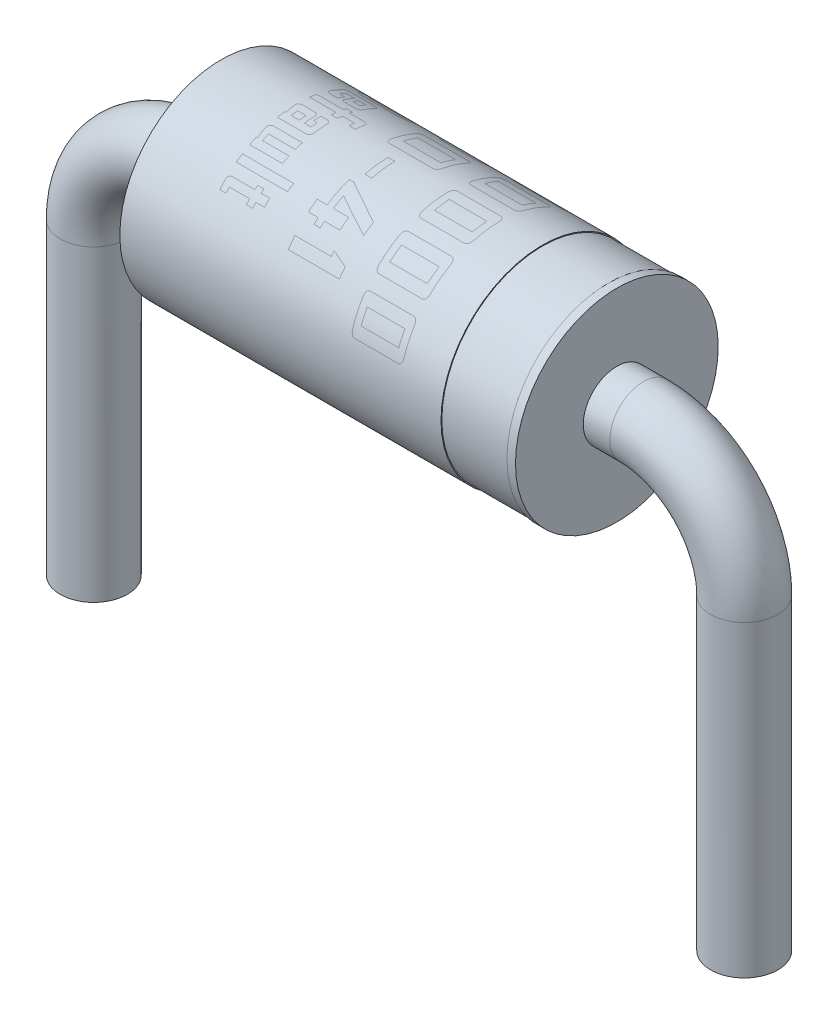
from build123d import *

# Parameters (mm, degrees)
SKETCH1_R     = 1.1875
BODY_DEPTH    = 2.3175
CATHODE_START = 0.1
SKETCH8_R     = 1.1975
SKETCH8_R_2   = 1.1775
CATHODE_DEPTH = 0.7725
SKETCH6_R     = 0.39375


with BuildPart() as part:
    # Sketch1 → BODY (new, symmetric)
    with BuildSketch(Plane(origin=(3.81, 0, 0), x_dir=(0, 0, -1), z_dir=(1, 0, 0))):
        with Locations((0, 2.1875)):
            Circle(SKETCH1_R)
    extrude(amount=BODY_DEPTH, both=True)

    # Sketch8 → CATHODE (cut)
    with BuildSketch(Plane.ZY.offset(-6.1275).offset(CATHODE_START)):
        with Locations((0, 2.1875)):
            Circle(SKETCH8_R)
        with Locations((0, 2.1875)):
            Circle(SKETCH8_R_2, mode=Mode.SUBTRACT)
    extrude(amount=CATHODE_DEPTH, mode=Mode.SUBTRACT)

    # PINS: sweep along a path in Sketch7
    with BuildLine(Plane.XY) as pins_path:
        Line((0, -2.6), (0, 1.00625))
        ThreePointArc((0, 1.00625), (0.345980115, 1.841519885), (1.18125, 2.1875))
        Line((1.18125, 2.1875), (6.43875, 2.1875))
        ThreePointArc((6.43875, 2.1875), (7.274019885, 1.841519885), (7.62, 1.00625))
        Line((7.62, 1.00625), (7.62, -2.6))
    # Sketch6 → PINS (sweep)
    with BuildSketch(Plane(origin=(3.81, 0, 0), x_dir=(0, 0, -1), z_dir=(1, 0, 0))):
        with Locations((0, 2.1875)):
            Circle(SKETCH6_R)
    sweep(path=pins_path.line)


solid = part.part
